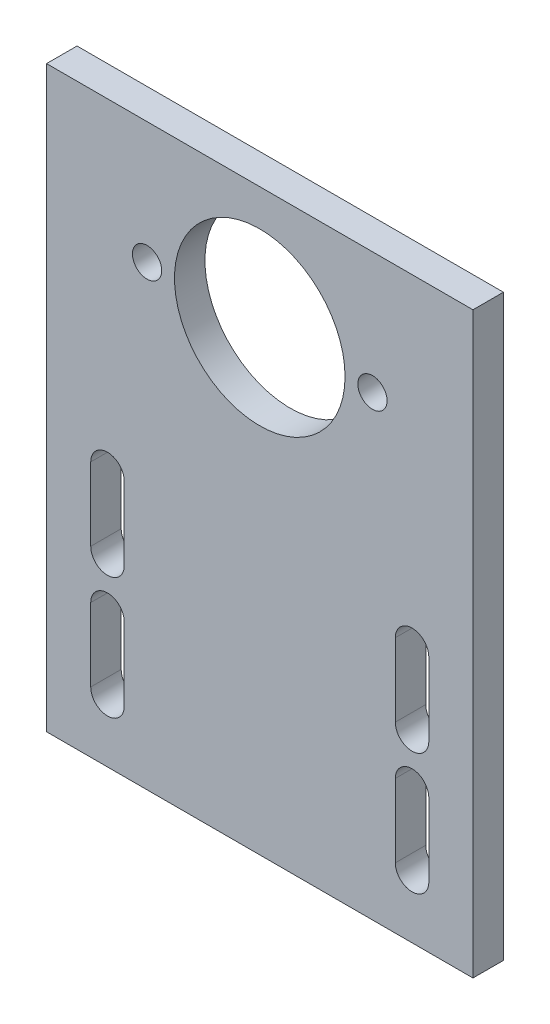
from build123d import *

# Parameters (mm, degrees)
SKETCH1_R           = 2.4
SKETCH1_R_2         = 14
BOSS_EXTRUDE1_DEPTH = 5


with BuildPart() as part:
    # Sketch1 → Boss-Extrude1 (new body)
    with BuildSketch(Plane.XY):
        Polygon((-35, 60), (-35, -15), (-35, -35), (35, -35), (35, -15), (35, 60), align=None)
        with BuildLine():
            ThreePointArc((-22.25, -25), (-25, -27.75), (-27.75, -25))
            Line((-27.75, -25), (-27.75, -13))
            ThreePointArc((-27.75, -13), (-25, -10.25), (-22.25, -13))
            Line((-22.25, -13), (-22.25, -25))
        make_face(mode=Mode.SUBTRACT)
        with BuildLine():
            ThreePointArc((-22.25, -5), (-25, -7.75), (-27.75, -5))
            Line((-27.75, -5), (-27.75, 7))
            ThreePointArc((-27.75, 7), (-25, 9.75), (-22.25, 7))
            Line((-22.25, 7), (-22.25, -5))
        make_face(mode=Mode.SUBTRACT)
        with BuildLine():
            Line((27.75, -13), (27.75, -25))
            ThreePointArc((27.75, -25), (25, -27.75), (22.25, -25))
            Line((22.25, -25), (22.25, -13))
            ThreePointArc((22.25, -13), (25, -10.25), (27.75, -13))
        make_face(mode=Mode.SUBTRACT)
        with BuildLine():
            Line((27.75, 7), (27.75, -5))
            ThreePointArc((27.75, -5), (25, -7.75), (22.25, -5))
            Line((22.25, -5), (22.25, 7))
            ThreePointArc((22.25, 7), (25, 9.75), (27.75, 7))
        make_face(mode=Mode.SUBTRACT)
        with Locations((-18.5, 40)):
            Circle(SKETCH1_R, mode=Mode.SUBTRACT)
        with Locations((0, 40)):
            Circle(SKETCH1_R_2, mode=Mode.SUBTRACT)
        with Locations((18.5, 40)):
            Circle(SKETCH1_R, mode=Mode.SUBTRACT)
    extrude(amount=BOSS_EXTRUDE1_DEPTH)


solid = part.part
